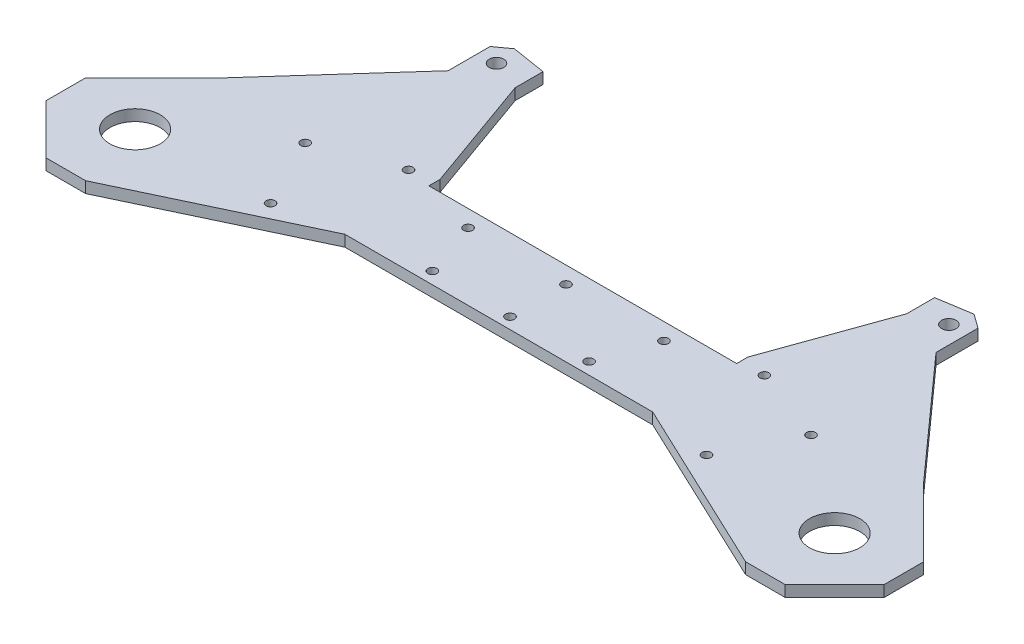
from build123d import *
from OCP.BRepFilletAPI import BRepFilletAPI_MakeChamfer

# Parameters (mm, degrees)
SKETCH_1_R          = 9
EXTRUDE_1_DEPTH     = 4
FILLET_3_R          = 50
CHAMFER_1_SIZE      = 10
FILLET_4_R          = 170
EXTRUDE_START       = -4
SKETCH_2_R          = 2.6
EXTRUDE_2_DEPTH     = 4
CHAMFER_2_SIZE      = 10
CHAMFER_2_SIZE2     = 10.024068518
FILLET_6_R          = 5
EXTRUDE_4_DEPTH     = 4
SKETCH_7_R          = 1.6
CUT_EXTRUDE_3_DEPTH = 10
CUT_EXTRUDE_4_DEPTH = 10
CUT_EXTRUDE_5_DEPTH = 10
EXTRUDE_6_DEPTH     = 4
EXTRUDE_7_DEPTH     = 4
CUT_EXTRUDE_START   = -4
CUT_EXTRUDE_6_DEPTH = 4
CUT_EXTRUDE_7_DEPTH = 10


with BuildPart() as part:
    # 草图1 → 凸台-拉伸1 (new body)
    with BuildSketch(Plane(origin=(0, 0, 0), x_dir=(1, 0, 0), z_dir=(0, 1, 0))):
        Polygon((5.303300859, 26.516504294), (0, 31.819805153), (-31.819805153, 0), (0, -31.819805153), (31.819805153, 0), (36.819805153, 5), (213.180194847, 5), (218.180194847, 0), (250, -31.819805153), (281.819805153, 0), (250, 31.819805153), (244.696699141, 26.516504294), (236.213203436, 35), (230, 35), (13.786796564, 35), align=None)
        with Locations(Location((0, 0, 0), (0, 0, 270))):
            Circle(SKETCH_1_R, mode=Mode.SUBTRACT)
        with Locations(Location((250, 0, 0), (0, 0, 270))):
            Circle(SKETCH_1_R, mode=Mode.SUBTRACT)
    extrude(amount=EXTRUDE_1_DEPTH)

    # 圆角3
    # the kernel refuses this fillet: 50 mm, written as the material it takes off along each edge
    with BuildSketch(Plane(origin=(236.213203436, -48.450245762, -35), x_dir=(-1, 0, 0), z_dir=(0, 1, 0))) as fillet_3_piece_1:
        with BuildLine():
            CenterArc((19.380098305, 50), FILLET_3_R, 236.132660747, 33.867339253)
            Line((-8.483495706, 8.483495706), (-9.040767586, 7.65316562))
            ThreePointArc((-9.040767586, 7.65316562), (-4.948854634, 3.534641072), (-0.707106781, -0.707106781))
            Line((-0.707106781, -0.707106781), (0, -1))
            Line((0, -1), (19.380098305, -1))
            Line((19.380098305, -1), (19.380098305, 0))
        make_face()
    extrude(amount=100.900491523, mode=Mode.SUBTRACT)
    with BuildSketch(Plane(origin=(13.786796564, -48.450245762, -35), x_dir=(1, 0, 0), z_dir=(0, 1, 0))) as fillet_3_piece_2:
        with BuildLine():
            CenterArc((19.380098305, -50), FILLET_3_R, 90, 33.867339253)
            Line((-8.483495706, -8.483495706), (-9.040767586, -7.65316562))
            ThreePointArc((-9.040767586, -7.65316562), (-4.948854634, -3.534641072), (-0.707106781, 0.707106781))
            Line((-0.707106781, 0.707106781), (0, 1))
            Line((0, 1), (19.380098305, 1))
            Line((19.380098305, 1), (19.380098305, 0))
        make_face()
    extrude(amount=100.900491523, mode=Mode.SUBTRACT)

    # 倒角1
    chamfer_1_edges = [part.edges().sort_by_distance(p)[0] for p in [
        (281.819805153, 2, 0),
        (250, 2, 31.819805153),
        (0, 2, 31.819805153),
        (-31.819805153, 2, 0),
    ]]
    chamfer(chamfer_1_edges, length=CHAMFER_1_SIZE)

    # 圆角4
    # the kernel refuses this fillet: 170 mm, written as the material it adds along each edge
    with BuildSketch(Plane(origin=(244.696699141, 0, -26.516504294), x_dir=(0.7071067811865487, 0, -0.7071067811865464), z_dir=(0, 1, 0))) as fillet_4_piece_1:
        with BuildLine():
            CenterArc((130.807104298, 117.027167913), FILLET_4_R, 215.157343004, 8.345858433)
            Line((-8.180446561, 19.137123955), (-10.960197579, 17.179323075))
            ThreePointArc((-10.960197579, 17.179323075), (-6.209829397, 8.662505006), (-3.336021383, -0.65647645))
            Line((-3.336021383, -0.65647645), (0, -3.4))
            ThreePointArc((0, -3.4), (3.75, -3.4), (5.033857914, -2.340543358))
            Line((5.033857914, -2.340543358), (7.5, 0))
        make_face()
    extrude(amount=4)
    with BuildSketch(Plane(origin=(5.303300859, 0, -26.516504294), x_dir=(-0.7071067811865499, 0, -0.707106781186545), z_dir=(0, 1, 0))) as fillet_4_piece_2:
        with BuildLine():
            CenterArc((130.807104298, -117.027167913), FILLET_4_R, 136.496798562, 8.345858433)
            Line((-8.180446561, -19.137123955), (-10.960197579, -17.179323075))
            ThreePointArc((-10.960197579, -17.179323075), (-6.209829397, -8.662505006), (-3.336021383, 0.65647645))
            Line((-3.336021383, 0.65647645), (0, 3.4))
            ThreePointArc((0, 3.4), (3.75, 3.4), (5.033857914, 2.340543358))
            Line((5.033857914, 2.340543358), (7.5, 0))
        make_face()
    extrude(amount=4)
    with BuildSketch(Plane(origin=(213.180194847, 0, -5), x_dir=(0.7071067811865461, 0, 0.707106781186549), z_dir=(0, 1, 0))) as fillet_4_piece_3:
        with BuildLine():
            CenterArc((73.311428823, -167.104876781), FILLET_4_R, 100.589244362, 34.410755638)
            Line((-46.896723979, -46.896723979), (-49.300887035, -44.492560923))
            Line((-49.300887035, -44.492560923), (-2.404163056, 2.404163056))
            Line((-2.404163056, 2.404163056), (0, 3.4))
            ThreePointArc((0, 3.4), (21.035533906, 3.4), (41.446260592, 3.342097536))
            Line((41.446260592, 3.342097536), (42.071067812, 0))
        make_face()
    extrude(amount=4)
    with BuildSketch(Plane(origin=(36.819805153, 0, -5), x_dir=(1, 0, 0), z_dir=(0, 1, 0))) as fillet_4_piece_4:
        with BuildLine():
            CenterArc((66.321983082, -170), FILLET_4_R, 90, 34.410755638)
            Line((-29.748737342, -29.748737342), (-31.67015175, -26.943712088))
            ThreePointArc((-31.67015175, -26.943712088), (-17.278531727, -12.470205615), (-2.404163056, 2.404163056))
            Line((-2.404163056, 2.404163056), (0, 3.4))
            Line((0, 3.4), (66.321983082, 3.4))
            Line((66.321983082, 3.4), (66.321983082, 0))
        make_face()
    extrude(amount=4)

    # 草图2 → 凸台-拉伸2 (add)
    # profile 1 of 2: a face of its own
    with BuildSketch(Plane(origin=(0, 4, 0), x_dir=(1, 0, 0), z_dir=(0, 1, 0)).offset(EXTRUDE_START)):
        with BuildLine():
            Line((33.166894869, 35), (70, 35))
            Line((70, 35), (70, 89.938046945))
            Line((70, 89.938046945), (52.173767708, 89.980797886))
            Line((52.173767708, 89.980797886), (45.293317142, 91.980771652))
            Line((45.293317142, 91.980771652), (41.239720179, 89.053596963))
            Line((41.239720179, 89.053596963), (37.186123217, 86.126422273))
            Line((37.186123217, 86.126422273), (34.934162449, 75.803316969))
            Line((34.934162449, 75.803316969), (0, 31.819805153))
            ThreePointArc((0, 31.819805153), (12.354394119, 32.593454654), (24.619740216, 34.264045178))
            ThreePointArc((24.619740216, 34.264045178), (28.877504407, 34.815671525), (33.166894869, 35))
        make_face()
        with Locations(Location((44.166894869, 85, 0), (0, 0, 270))):
            Circle(SKETCH_2_R, mode=Mode.SUBTRACT)
    # profile 2 of 2: a face of its own
    with BuildSketch(Plane(origin=(0, 4, 0), x_dir=(1, 0, 0), z_dir=(0, 1, 0)).offset(EXTRUDE_START)):
        with BuildLine():
            Line((180, 89.938046945), (197.826232292, 89.980797886))
            Line((197.826232292, 89.980797886), (204.706682858, 91.980771652))
            Line((204.706682858, 91.980771652), (208.760279821, 89.053596963))
            Line((208.760279821, 89.053596963), (212.813876783, 86.126422273))
            Line((212.813876783, 86.126422273), (215.065837551, 75.803316969))
            Line((215.065837551, 75.803316969), (250, 31.819805153))
            ThreePointArc((250, 31.819805153), (237.645605881, 32.593454654), (225.380259784, 34.264045178))
            ThreePointArc((225.380259784, 34.264045178), (221.122495593, 34.815671525), (216.833105131, 35))
            Line((216.833105131, 35), (180, 35))
            Line((180, 35), (180, 89.938046945))
        make_face()
        with Locations(Location((205.833105131, 85, 0), (0, 0, 270))):
            Circle(SKETCH_2_R, mode=Mode.SUBTRACT)
    extrude(amount=EXTRUDE_2_DEPTH)

    # 倒角2: one chamfer whose edges measure the first distance from different faces: ONE call of the kernel's chamfer builder (chamfer() names one face for all edges)
    chamfer_2_edges_1 = [part.edges().sort_by_distance(p)[0] for p in [
        (70, 2, -89.938046945),
    ]]
    chamfer_2_side_1 = [part.faces().sort_by_distance(p)[0] for p in [
        (61.086883854, 2, -89.959422415),
    ]]
    chamfer_2_edges_2 = [part.edges().sort_by_distance(p)[0] for p in [
        (180, 2, -89.938046945),
    ]]
    chamfer_2_side_2 = [part.faces().sort_by_distance(p)[0] for p in [
        (180, 2, -62.469023472),
    ]]
    chamfer_2 = BRepFilletAPI_MakeChamfer(part.part.solid().wrapped)
    for e in chamfer_2_edges_1:
        chamfer_2.Add(CHAMFER_2_SIZE, CHAMFER_2_SIZE2, e.wrapped, chamfer_2_side_1[0].wrapped)  # the first distance lies on this face
    for e in chamfer_2_edges_2:
        chamfer_2.Add(CHAMFER_2_SIZE, CHAMFER_2_SIZE2, e.wrapped, chamfer_2_side_2[0].wrapped)  # the first distance lies on this face
    add(Compound.cast(chamfer_2.Shape()), mode=Mode.REPLACE)

    # 圆角6
    fillet_6_edges = [part.edges().sort_by_distance(p)[0] for p in [
        (34.934162449, 2, -75.803316969),
        (52.173767708, 2, -89.980797886),
        (197.826232292, 2, -89.980797886),
    ]]
    fillet(fillet_6_edges, radius=FILLET_6_R)

    # 草图6 → 凸台-拉伸4 (add)
    with BuildSketch(Plane(origin=(0, 4, 0), x_dir=(1, 0, 0), z_dir=(0, 1, 0))):
        Polygon((37.186123217, 86.126422273), (37.824908007, 89.054644979), (42.857532511, 92.688792925), (45.293317142, 91.980771652), align=None)
        Polygon((212.175091993, 89.054644979), (207.142467489, 92.688792925), (204.706682858, 91.980771652), (212.813876783, 86.126422273), align=None)
    extrude(amount=-EXTRUDE_4_DEPTH)

    # 草图7 → 切除-拉伸3 (cut)
    with BuildSketch(Plane(origin=(0, 4, 0), x_dir=(1, 0, 0), z_dir=(0, 1, 0))):
        with Locations(Location((34.609562391, 26.172761135, 0), (0, 0, 270))):
            Circle(SKETCH_7_R)
        with Locations(Location((47.113684451, 1.312769582, 0), (0, 0, 270))):
            Circle(SKETCH_7_R)
        with Locations(Location((97, 9.255699158, 0), (0, 0, 270))):
            Circle(SKETCH_7_R)
        with Locations(Location((125, 29, 0), (0, 0, 270))):
            Circle(SKETCH_7_R)
        with Locations(Location((125, 9, 0), (0, 0, 270))):
            Circle(SKETCH_7_R)
        with Locations(Location((61.416561737, 36.309705645, 0), (0, 0, 270))):
            Circle(SKETCH_7_R)
        with Locations(Location((188.583438263, 36.309705645, 0), (0, 0, 270))):
            Circle(SKETCH_7_R)
        with Locations(Location((153, 9.255699158, 0), (0, 0, 270))):
            Circle(SKETCH_7_R)
        with Locations(Location((202.886315549, 1.312769582, 0), (0, 0, 270))):
            Circle(SKETCH_7_R)
        with Locations(Location((215.390437609, 26.172761135, 0), (0, 0, 270))):
            Circle(SKETCH_7_R)
        with Locations(Location((90, 29, 0), (0, 0, 270))):
            Circle(SKETCH_7_R)
        with Locations(Location((160, 29, 0), (0, 0, 270))):
            Circle(SKETCH_7_R)
    extrude(amount=-CUT_EXTRUDE_3_DEPTH, mode=Mode.SUBTRACT)

    # 草图8 → 切除-拉伸4 (cut)
    with BuildSketch(Plane(origin=(0, 4, 0), x_dir=(1, 0, 0), z_dir=(0, 1, 0))):
        with BuildLine():
            Line((37.824908007, 89.054644979), (0, 89.054644979))
            Line((0, 89.054644979), (0, 31.819805153))
            Line((0, 31.819805153), (34.211863658, 74.893913817))
            ThreePointArc((34.211863658, 74.893913817), (34.813909711, 75.860371791), (35.181686599, 76.937980545))
            Line((35.181686599, 76.937980545), (37.824908007, 89.054644979))
        make_face()
        with BuildLine():
            Line((37.824908007, 74.054644979), (0, 31.819805153))
            Line((0, 31.819805153), (34.211863658, 74.893913817))
            ThreePointArc((34.211863658, 74.893913817), (34.813909711, 75.860371791), (35.181686599, 76.937980545))
            Line((35.181686599, 76.937980545), (37.824908007, 89.054644979))
            Line((37.824908007, 89.054644979), (37.824908007, 74.054644979))
        make_face()
        Polygon((212.175091993, 89.054644979), (212.175091993, 74.054644979), (250, 31.819805153), (215.065837551, 75.803316969), align=None)
        Polygon((250, 89.054644979), (250, 31.819805153), (215.065837551, 75.803316969), (212.175091993, 89.054644979), align=None)
    extrude(amount=-CUT_EXTRUDE_4_DEPTH, mode=Mode.SUBTRACT)

    # 草图10 → 切除-拉伸5 (cut)
    with BuildSketch(Plane(origin=(0, 4, 0), x_dir=(1, 0, 0), z_dir=(0, 1, 0))):
        Polygon((60.000028757, 89.962028915), (70, 39), (70, 79.913978427), align=None)
        Polygon((190.024039692, 89.962086636), (180, 39), (180, 79.938046945), align=None)
    extrude(amount=-CUT_EXTRUDE_5_DEPTH, mode=Mode.SUBTRACT)

    # 草图11 → 凸台-拉伸6 (add)
    with BuildSketch(Plane(origin=(0, 4, 0), x_dir=(1, 0, 0), z_dir=(0, 1, 0))):
        Polygon((42.857532511, 92.688792925), (60.000028757, 89.962028915), (60.948179485, 85.13004654), align=None)
        Polygon((190.024039692, 89.962086636), (207.142467489, 92.688792925), (188.87547831, 84.122815598), align=None)
    extrude(amount=-EXTRUDE_6_DEPTH)

    # 草图12 → 凸台-拉伸7 (add)
    with BuildSketch(Plane(origin=(0, 4, 0), x_dir=(1, 0, 0), z_dir=(0, 1, 0)).offset(EXTRUDE_START)):
        with BuildLine():
            Line((7.071067812, -24.748737342), (55.733906645, -1.744088122))
            ThreePointArc((55.733906645, -1.744088122), (30.48622561, -11.308200545), (7.071067812, -24.748737342))
        make_face()
        with BuildLine():
            ThreePointArc((242.928932188, -24.748737342), (219.51377439, -11.308200545), (194.266093355, -1.744088122))
            Line((194.266093355, -1.744088122), (242.928932188, -24.748737342))
        make_face()
        with BuildLine():
            Line((188.394190901, 5), (180, 5))
            Line((180, 5), (194.266093355, -1.744088122))
            ThreePointArc((194.266093355, -1.744088122), (219.51377439, -11.308200545), (242.928932188, -24.748737342))
            Line((242.928932188, -24.748737342), (242.928932188, -20.020632947))
            Line((242.928932188, -20.020632947), (188.394190901, 5))
        make_face()
        with BuildLine():
            Line((55.733906645, -1.744088122), (70, 5))
            Line((70, 5), (63.353452333, 5))
            Line((63.353452333, 5), (4.835925233, -20.020632947))
            Line((4.835925233, -20.020632947), (7.071067812, -24.748737342))
            ThreePointArc((7.071067812, -24.748737342), (30.48622561, -11.308200545), (55.733906645, -1.744088122))
        make_face()
    extrude(amount=EXTRUDE_7_DEPTH)

    # 草图13 → 切除-拉伸6 (cut)
    with BuildSketch(Plane(origin=(0, 4, 0), x_dir=(1, 0, 0), z_dir=(0, 1, 0)).offset(CUT_EXTRUDE_START)):
        with BuildLine():
            ThreePointArc((55.733906645, -1.744088122), (79.199200857, 3.305533212), (103.141788235, 5))
            Line((103.141788235, 5), (70, 5))
            Line((70, 5), (55.733906645, -1.744088122))
        make_face()
        with BuildLine():
            Line((55.733906645, -1.744088122), (194.266093355, -1.744088122))
            ThreePointArc((194.266093355, -1.744088122), (170.800799143, 3.305533212), (146.858211765, 5))
            Line((146.858211765, 5), (103.141788235, 5))
            ThreePointArc((103.141788235, 5), (79.199200857, 3.305533212), (55.733906645, -1.744088122))
        make_face()
        with BuildLine():
            Line((180, 5), (146.858211765, 5))
            ThreePointArc((146.858211765, 5), (170.800799143, 3.305533212), (194.266093355, -1.744088122))
            Line((194.266093355, -1.744088122), (180, 5))
        make_face()
    extrude(amount=CUT_EXTRUDE_6_DEPTH, mode=Mode.SUBTRACT)

    # 草图14 → 切除-拉伸7 (cut)
    with BuildSketch(Plane(origin=(0, 4, 0), x_dir=(1, 0, 0), z_dir=(0, 1, 0))):
        Polygon((55.062107056, 90.747477369), (55.062107056, 80.747477369), (70, 39), (60.000028757, 89.962028915), align=None)
        Polygon((194.961792542, 90.748595883), (194.961792542, 80.748595883), (180, 39), (190.024039692, 89.962086636), align=None)
    extrude(amount=-CUT_EXTRUDE_7_DEPTH, mode=Mode.SUBTRACT)


solid = part.part
